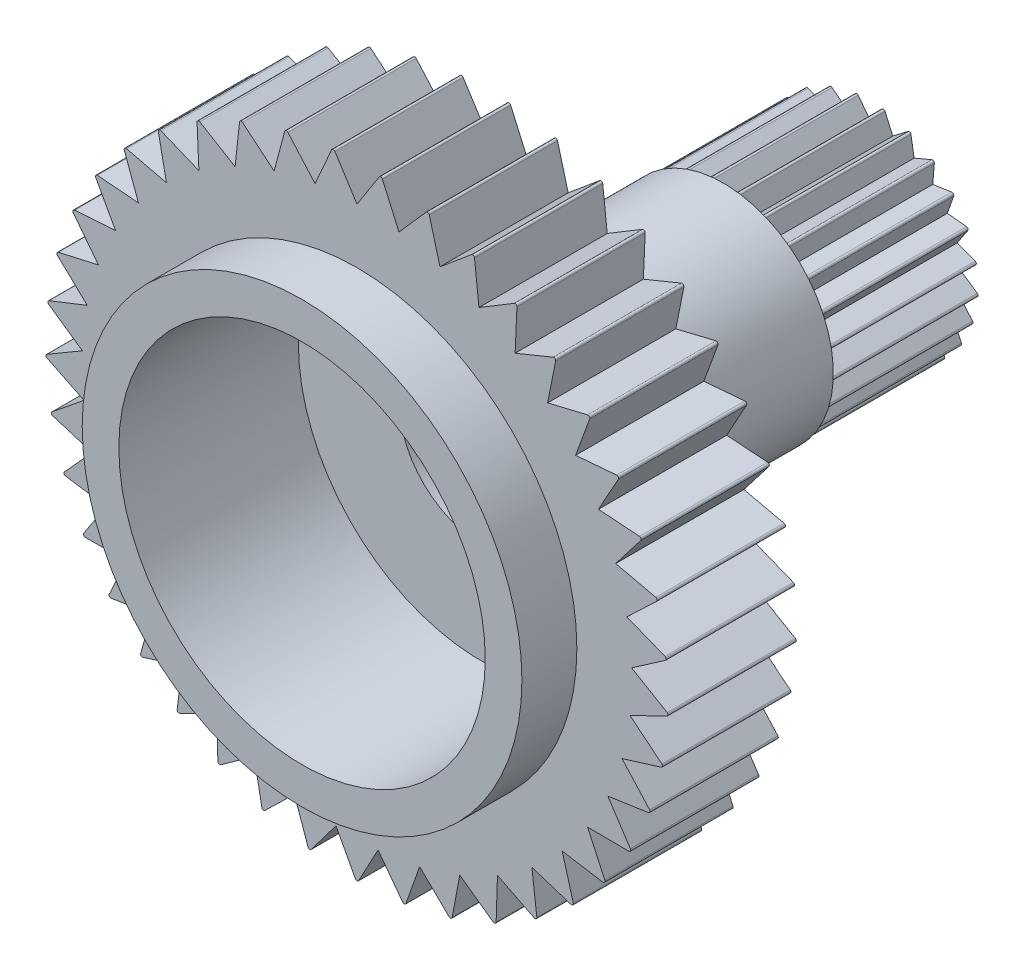
from build123d import *

# Parameters (mm, degrees)
SKETCH_1_R              = 8.55
EXTRUDE_1_DEPTH         = 3.5
SKETCH_2_R              = 6
EXTRUDE_2_DEPTH         = 1.5
SKETCH_3_R              = 3.85
EXTRUDE_3_DEPTH         = 2.4
SKETCH_4_R              = 3
EXTRUDE_4_DEPTH         = 8.1
SKETCH_5_R              = 5
CUT_EXTRUDE_5_DEPTH     = 4.9
SKETCH_6_R              = 2.25
CUT_EXTRUDE_6_DEPTH     = 2.2
CUT_EXTRUDE_START       = -4
CUT_EXTRUDE_7_OUTLINE_R = 3
CUT_EXTRUDE_7_DEPTH     = 4
SKETCH_8_R              = 1
CUT_EXTRUDE_8_DEPTH     = 7.5
CUT_EXTRUDE_START_2     = -3.5
CUT_EXTRUDE_9_OUTLINE_R = 8.55
CUT_EXTRUDE_9_DEPTH     = 3.5


# Read off the part's stored shape, not the designer's step: 伸長7, 伸長9
with BuildPart() as part:
    # 草圖1 → 伸長1 (new body)
    with BuildSketch(Plane.XY):
        Circle(SKETCH_1_R)
    extrude(amount=EXTRUDE_1_DEPTH)

    # 草圖2 → 伸長2 (add)
    with BuildSketch(Plane.XY.offset(3.5)):
        Circle(SKETCH_2_R)
    extrude(amount=EXTRUDE_2_DEPTH)

    # 草圖3 → 伸長3 (add)
    with BuildSketch(Plane(origin=(0, 0, 0), x_dir=(-1, 0, 0), z_dir=(0, 0, -1))):
        with Locations(Location((0, 0, 0), (0, 0, 180))):
            Circle(SKETCH_3_R)
    extrude(amount=EXTRUDE_3_DEPTH)

    # 草圖4 → 伸長4 (add)
    with BuildSketch(Plane(origin=(0, 0, -2.4), x_dir=(-1, 0, 0), z_dir=(0, 0, -1))):
        Circle(SKETCH_4_R)
    extrude(amount=EXTRUDE_4_DEPTH)

    # 草圖5 → 伸長5 (cut)
    with BuildSketch(Plane.XY.offset(5)):
        Circle(SKETCH_5_R)
    extrude(amount=-CUT_EXTRUDE_5_DEPTH, mode=Mode.SUBTRACT)

    # 草圖6 → 伸長6 (cut)
    with BuildSketch(Plane.XY.offset(0.1)):
        Circle(SKETCH_6_R)
    extrude(amount=-CUT_EXTRUDE_6_DEPTH, mode=Mode.SUBTRACT)

    # 伸長7 outline → 伸長7 (cut)
    with BuildSketch(Plane(origin=(0, 0, -10.5), x_dir=(-1, 0, 0), z_dir=(0, 0, -1)).offset(CUT_EXTRUDE_START)):
        Circle(CUT_EXTRUDE_7_OUTLINE_R)
        with BuildLine():
            Line((-0.324615894, 2.911247314), (0, 2.5))
            Line((0, 2.5), (0.324615894, 2.911247314))
            ThreePointArc((0.324615894, 2.911247314), (0.370129155, 2.929873953), (0.409580277, 2.900513817))
            Line((0.409580277, 2.900513817), (0.621724718, 2.421457903))
            Line((0.621724718, 2.421457903), (1.038415255, 2.739056437))
            ThreePointArc((1.038415255, 2.739056437), (1.08713089, 2.745779197), (1.118041014, 2.707530368))
            Line((1.118041014, 2.707530368), (1.204384185, 2.1907667))
            Line((1.204384185, 2.1907667), (1.686967166, 2.394760569))
            ThreePointArc((1.686967166, 2.394760569), (1.735824193, 2.389157036), (1.756251121, 2.34442283))
            Line((1.756251121, 2.34442283), (1.711367765, 1.822421569))
            Line((1.711367765, 1.822421569), (2.229520726, 1.899993088))
            ThreePointArc((2.229520726, 1.899993088), (2.275449278, 1.882415352), (2.284109512, 1.834006582))
            Line((2.284109512, 1.834006582), (2.110819814, 1.339566987))
            Line((2.110819814, 1.339566987), (2.6319853, 1.285842054))
            ThreePointArc((2.6319853, 1.285842054), (2.672099516, 1.257394588), (2.668448901, 1.208352956))
            Line((2.668448901, 1.208352956), (2.377641291, 0.772542486))
            Line((2.377641291, 0.772542486), (2.869072557, 0.590896834))
            ThreePointArc((2.869072557, 0.590896834), (2.900851914, 0.553367098), (2.885119832, 0.50677407))
            Line((2.885119832, 0.50677407), (2.495066821, 0.156976299))
            Line((2.495066821, 0.156976299), (2.925885433, -0.141176607))
            ThreePointArc((2.925885433, -0.141176607), (2.947333118, -0.185430482), (2.920508074, -0.226647295))
            Line((2.920508074, -0.226647295), (2.455718127, -0.468453286))
            Line((2.455718127, -0.468453286), (2.798854168, -0.864379403))
            ThreePointArc((2.798854168, -0.864379403), (2.808622543, -0.912576784), (2.772390052, -0.945827577))
            Line((2.772390052, -0.945827577), (2.262067631, -1.064448229))
            Line((2.262067631, -1.064448229), (2.495960601, -1.533270062))
            ThreePointArc((2.495960601, -1.533270062), (2.493435884, -1.582382529), (2.450072567, -1.605578033))
            Line((2.450072567, -1.605578033), (1.926283107, -1.593559974))
            Line((1.926283107, -1.593559974), (2.03623665, -2.105819723))
            ThreePointArc((2.03623665, -2.105819723), (2.021577478, -2.152761361), (1.973808012, -2.164444117))
            Line((1.973808012, -2.164444117), (1.469463131, -2.022542486))
            Line((1.469463131, -2.022542486), (1.448568462, -2.546052987))
            ThreePointArc((1.448568462, -2.546052987), (1.422695924, -2.587874279), (1.37352184, -2.587310217))
            Line((1.37352184, -2.587310217), (0.920311382, -2.324441215))
            Line((0.920311382, -2.324441215), (0.76988139, -2.826308378))
            ThreePointArc((0.76988139, -2.826308378), (0.734421153, -2.860381538), (0.68693224, -2.8476061))
            Line((0.68693224, -2.8476061), (0.313333084, -2.480286753))
            Line((0.313333084, -2.480286753), (0.042819839, -2.928976419))
            ThreePointArc((0.042819839, -2.928976419), (0, -2.953160506), (-0.042819839, -2.928976419))
            Line((-0.042819839, -2.928976419), (-0.313333084, -2.480286753))
            Line((-0.313333084, -2.480286753), (-0.68693224, -2.8476061))
            ThreePointArc((-0.68693224, -2.8476061), (-0.734421153, -2.860381538), (-0.76988139, -2.826308378))
            Line((-0.76988139, -2.826308378), (-0.920311382, -2.324441215))
            Line((-0.920311382, -2.324441215), (-1.37352184, -2.587310217))
            ThreePointArc((-1.37352184, -2.587310217), (-1.422695924, -2.587874279), (-1.448568462, -2.546052987))
            Line((-1.448568462, -2.546052987), (-1.469463131, -2.022542486))
            Line((-1.469463131, -2.022542486), (-1.973808012, -2.164444117))
            ThreePointArc((-1.973808012, -2.164444117), (-2.021577478, -2.152761361), (-2.03623665, -2.105819723))
            Line((-2.03623665, -2.105819723), (-1.926283107, -1.593559974))
            Line((-1.926283107, -1.593559974), (-2.450072567, -1.605578033))
            ThreePointArc((-2.450072567, -1.605578033), (-2.493435884, -1.582382529), (-2.495960601, -1.533270062))
            Line((-2.495960601, -1.533270062), (-2.262067631, -1.064448229))
            Line((-2.262067631, -1.064448229), (-2.772390052, -0.945827577))
            ThreePointArc((-2.772390052, -0.945827577), (-2.808622543, -0.912576784), (-2.798854168, -0.864379403))
            Line((-2.798854168, -0.864379403), (-2.455718127, -0.468453286))
            Line((-2.455718127, -0.468453286), (-2.920508074, -0.226647295))
            ThreePointArc((-2.920508074, -0.226647295), (-2.947333118, -0.185430482), (-2.925885433, -0.141176607))
            Line((-2.925885433, -0.141176607), (-2.495066821, 0.156976299))
            Line((-2.495066821, 0.156976299), (-2.885119832, 0.50677407))
            ThreePointArc((-2.885119832, 0.50677407), (-2.900851914, 0.553367098), (-2.869072557, 0.590896834))
            Line((-2.869072557, 0.590896834), (-2.377641291, 0.772542486))
            Line((-2.377641291, 0.772542486), (-2.668448901, 1.208352956))
            ThreePointArc((-2.668448901, 1.208352956), (-2.672099516, 1.257394588), (-2.6319853, 1.285842054))
            Line((-2.6319853, 1.285842054), (-2.110819814, 1.339566987))
            Line((-2.110819814, 1.339566987), (-2.284109512, 1.834006582))
            ThreePointArc((-2.284109512, 1.834006582), (-2.275449278, 1.882415352), (-2.229520726, 1.899993088))
            Line((-2.229520726, 1.899993088), (-1.711367765, 1.822421569))
            Line((-1.711367765, 1.822421569), (-1.756251121, 2.34442283))
            ThreePointArc((-1.756251121, 2.34442283), (-1.735824193, 2.389157036), (-1.686967166, 2.394760569))
            Line((-1.686967166, 2.394760569), (-1.204384185, 2.1907667))
            Line((-1.204384185, 2.1907667), (-1.118041014, 2.707530368))
            ThreePointArc((-1.118041014, 2.707530368), (-1.08713089, 2.745779197), (-1.038415255, 2.739056437))
            Line((-1.038415255, 2.739056437), (-0.621724718, 2.421457903))
            Line((-0.621724718, 2.421457903), (-0.409580277, 2.900513817))
            ThreePointArc((-0.409580277, 2.900513817), (-0.370129155, 2.929873953), (-0.324615894, 2.911247314))
        make_face(mode=Mode.SUBTRACT)
    extrude(amount=CUT_EXTRUDE_7_DEPTH, mode=Mode.SUBTRACT)

    # 草圖8 → 伸長8 (cut)
    with BuildSketch(Plane(origin=(0, 0, -10.5), x_dir=(-1, 0, 0), z_dir=(0, 0, -1))):
        Circle(SKETCH_8_R)
    extrude(amount=-CUT_EXTRUDE_8_DEPTH, mode=Mode.SUBTRACT)

    # 伸長9 outline → 伸長9 (cut)
    with BuildSketch(Plane.XY.offset(3.5).offset(CUT_EXTRUDE_START_2)):
        Circle(CUT_EXTRUDE_9_OUTLINE_R)
        with BuildLine():
            Line((-0.604248441, 8.446226921), (0, 7.5))
            Line((0, 7.5), (0.604248441, 8.446226921))
            ThreePointArc((0.604248441, 8.446226921), (0.650216483, 8.469169775), (0.692143589, 8.439478813))
            Line((0.692143589, 8.439478813), (1.144869632, 7.412103178))
            Line((1.144869632, 7.412103178), (1.886477399, 8.255002629))
            ThreePointArc((1.886477399, 8.255002629), (1.935408925, 8.270659614), (1.972312359, 8.234916474))
            Line((1.972312359, 8.234916474), (2.262904489, 7.15047294))
            Line((2.262904489, 7.15047294), (3.124488926, 7.870288072))
            ThreePointArc((3.124488926, 7.870288072), (3.175237023, 7.878292201), (3.206251799, 7.837334673))
            Line((3.206251799, 7.837334673), (3.327898784, 6.721241677))
            Line((3.327898784, 6.721241677), (4.289265081, 7.301100633))
            ThreePointArc((4.289265081, 7.301100633), (4.340640256, 7.301264296), (4.365039415, 7.25605239))
            Line((4.365039415, 7.25605239), (4.314889952, 6.134470206))
            Line((4.314889952, 6.134470206), (5.353504497, 6.560781583))
            ThreePointArc((5.353504497, 6.560781583), (5.40430256, 6.553100944), (5.421514207, 6.504694389))
            Line((5.421514207, 6.504694389), (5.200743756, 5.403911952))
            Line((5.200743756, 5.403911952), (6.292262306, 5.666683374))
            ThreePointArc((6.292262306, 5.666683374), (6.341292593, 5.651338461), (6.3509133, 5.600871864))
            Line((6.3509133, 5.600871864), (5.964696535, 4.546690582))
            Line((5.964696535, 4.546690582), (7.083534819, 4.639762909))
            ThreePointArc((7.083534819, 4.639762909), (7.129648102, 4.617113394), (7.131452369, 4.56576965))
            Line((7.131452369, 4.56576965), (6.588841882, 3.582898639))
            Line((6.588841882, 3.582898639), (7.70877528, 3.504090334))
            ThreePointArc((7.70877528, 3.504090334), (7.750890703, 3.474667102), (7.744836238, 3.423649665))
            Line((7.744836238, 3.423649665), (7.05855036, 2.535126588))
            Line((7.05855036, 2.535126588), (8.153328582, 2.286284851))
            ThreePointArc((8.153328582, 2.286284851), (8.190458994, 2.250777558), (8.17668771, 2.201282234))
            Line((8.17668771, 2.201282234), (7.3628124, 1.427933319))
            Line((7.3628124, 1.427933319), (8.406774772, 1.01489079))
            ThreePointArc((8.406774772, 1.01489079), (8.438049869, 0.974131696), (8.416884553, 0.927318612))
            Line((8.416884553, 0.927318612), (7.494496358, 0.287270503))
            Line((7.494496358, 0.287270503), (8.463173287, -0.280291452))
            ThreePointArc((8.463173287, -0.280291452), (8.487860006, -0.325346987), (8.459796755, -0.368380571))
            Line((8.459796755, -0.368380571), (7.450515673, -0.86012569))
            Line((7.450515673, -0.86012569), (8.321202193, -1.568903899))
            ThreePointArc((8.321202193, -1.568903899), (8.338721899, -1.617199813), (8.304418492, -1.655445226))
            Line((8.304418492, -1.655445226), (7.231901216, -1.987361266))
            Line((7.231901216, -1.987361266), (7.984189173, -2.820742569))
            ThreePointArc((7.984189173, -2.820742569), (7.994131219, -2.871146846), (7.954391697, -2.903707648))
            Line((7.954391697, -2.903707648), (6.843777124, -3.068014779))
            Line((6.843777124, -3.068014779), (7.460033525, -4.006465424))
            ThreePointArc((7.460033525, -4.006465424), (7.462164878, -4.05779663), (7.417920704, -4.083909624))
            Line((7.417920704, -4.083909624), (6.295240696, -4.076756625))
            Line((6.295240696, -4.076756625), (6.761021014, -5.098280124))
            ThreePointArc((6.761021014, -5.098280124), (6.755291717, -5.1493351), (6.707579936, -5.16838822))
            Line((6.707579936, -5.16838822), (5.599149162, -4.989942751))
            Line((5.599149162, -4.989942751), (5.903535901, -6.07059546))
            ThreePointArc((5.903535901, -6.07059546), (5.890080243, -6.12017752), (5.840019179, -6.131724176))
            Line((5.840019179, -6.131724176), (4.771818317, -5.786168849))
            Line((4.771818317, -5.786168849), (4.907676911, -6.900621184))
            ThreePointArc((4.907676911, -6.900621184), (4.886810281, -6.947568167), (4.835573323, -6.951337715))
            Line((4.835573323, -6.951337715), (3.832640096, -6.446772052))
            Line((3.832640096, -6.446772052), (3.796786133, -7.568902196))
            ThreePointArc((3.796786133, -7.568902196), (3.768997628, -7.612113703), (3.717785726, -7.608017789))
            Line((3.717785726, -7.608017789), (2.803628039, -6.956268383))
            Line((2.803628039, -6.956268383), (2.596901906, -8.059774555))
            ThreePointArc((2.596901906, -8.059774555), (2.562842865, -8.098237747), (2.512856383, -8.086372375))
            Line((2.512856383, -8.086372375), (1.708901317, -7.302715679))
            Line((1.708901317, -7.302715679), (1.336148499, -8.36173263))
            ThreePointArc((1.336148499, -8.36173263), (1.296617237, -8.394545961), (1.249027816, -8.375189245))
            Line((1.249027816, -8.375189245), (0.574119396, -7.477993509))
            Line((0.574119396, -7.477993509), (0.044076904, -8.467698779))
            ThreePointArc((0.044076904, -8.467698779), (0, -8.494093133), (-0.044076904, -8.467698779))
            Line((-0.044076904, -8.467698779), (-0.574119396, -7.477993509))
            Line((-0.574119396, -7.477993509), (-1.249027816, -8.375189245))
            ThreePointArc((-1.249027816, -8.375189245), (-1.296617237, -8.394545961), (-1.336148499, -8.36173263))
            Line((-1.336148499, -8.36173263), (-1.708901317, -7.302715679))
            Line((-1.708901317, -7.302715679), (-2.512856383, -8.086372375))
            ThreePointArc((-2.512856383, -8.086372375), (-2.562842865, -8.098237747), (-2.596901906, -8.059774555))
            Line((-2.596901906, -8.059774555), (-2.803628039, -6.956268383))
            Line((-2.803628039, -6.956268383), (-3.717785726, -7.608017789))
            ThreePointArc((-3.717785726, -7.608017789), (-3.768997628, -7.612113703), (-3.796786133, -7.568902196))
            Line((-3.796786133, -7.568902196), (-3.832640096, -6.446772052))
            Line((-3.832640096, -6.446772052), (-4.835573323, -6.951337715))
            ThreePointArc((-4.835573323, -6.951337715), (-4.886810281, -6.947568167), (-4.907676911, -6.900621184))
            Line((-4.907676911, -6.900621184), (-4.771818317, -5.786168849))
            Line((-4.771818317, -5.786168849), (-5.840019179, -6.131724176))
            ThreePointArc((-5.840019179, -6.131724176), (-5.890080243, -6.12017752), (-5.903535901, -6.07059546))
            Line((-5.903535901, -6.07059546), (-5.599149162, -4.989942751))
            Line((-5.599149162, -4.989942751), (-6.707579936, -5.16838822))
            ThreePointArc((-6.707579936, -5.16838822), (-6.755291717, -5.1493351), (-6.761021014, -5.098280124))
            Line((-6.761021014, -5.098280124), (-6.295240696, -4.076756625))
            Line((-6.295240696, -4.076756625), (-7.417920704, -4.083909624))
            ThreePointArc((-7.417920704, -4.083909624), (-7.462164878, -4.05779663), (-7.460033525, -4.006465424))
            Line((-7.460033525, -4.006465424), (-6.843777124, -3.068014779))
            Line((-6.843777124, -3.068014779), (-7.954391697, -2.903707648))
            ThreePointArc((-7.954391697, -2.903707648), (-7.994131219, -2.871146846), (-7.984189173, -2.820742569))
            Line((-7.984189173, -2.820742569), (-7.231901216, -1.987361266))
            Line((-7.231901216, -1.987361266), (-8.304418492, -1.655445226))
            ThreePointArc((-8.304418492, -1.655445226), (-8.338721899, -1.617199813), (-8.321202193, -1.568903899))
            Line((-8.321202193, -1.568903899), (-7.450515673, -0.86012569))
            Line((-7.450515673, -0.86012569), (-8.459796755, -0.368380571))
            ThreePointArc((-8.459796755, -0.368380571), (-8.487860006, -0.325346987), (-8.463173287, -0.280291452))
            Line((-8.463173287, -0.280291452), (-7.494496358, 0.287270503))
            Line((-7.494496358, 0.287270503), (-8.416884553, 0.927318612))
            ThreePointArc((-8.416884553, 0.927318612), (-8.438049869, 0.974131696), (-8.406774772, 1.01489079))
            Line((-8.406774772, 1.01489079), (-7.3628124, 1.427933319))
            Line((-7.3628124, 1.427933319), (-8.17668771, 2.201282234))
            ThreePointArc((-8.17668771, 2.201282234), (-8.190458994, 2.250777558), (-8.153328582, 2.286284851))
            Line((-8.153328582, 2.286284851), (-7.05855036, 2.535126588))
            Line((-7.05855036, 2.535126588), (-7.744836238, 3.423649665))
            ThreePointArc((-7.744836238, 3.423649665), (-7.750890703, 3.474667102), (-7.70877528, 3.504090334))
            Line((-7.70877528, 3.504090334), (-6.588841882, 3.582898639))
            Line((-6.588841882, 3.582898639), (-7.131452369, 4.56576965))
            ThreePointArc((-7.131452369, 4.56576965), (-7.129648102, 4.617113394), (-7.083534819, 4.639762909))
            Line((-7.083534819, 4.639762909), (-5.964696535, 4.546690582))
            Line((-5.964696535, 4.546690582), (-6.3509133, 5.600871864))
            ThreePointArc((-6.3509133, 5.600871864), (-6.341292593, 5.651338461), (-6.292262306, 5.666683374))
            Line((-6.292262306, 5.666683374), (-5.200743756, 5.403911952))
            Line((-5.200743756, 5.403911952), (-5.421514207, 6.504694389))
            ThreePointArc((-5.421514207, 6.504694389), (-5.40430256, 6.553100944), (-5.353504497, 6.560781583))
            Line((-5.353504497, 6.560781583), (-4.314889952, 6.134470206))
            Line((-4.314889952, 6.134470206), (-4.365039415, 7.25605239))
            ThreePointArc((-4.365039415, 7.25605239), (-4.340640256, 7.301264296), (-4.289265081, 7.301100633))
            Line((-4.289265081, 7.301100633), (-3.327898784, 6.721241677))
            Line((-3.327898784, 6.721241677), (-3.206251799, 7.837334673))
            ThreePointArc((-3.206251799, 7.837334673), (-3.175237023, 7.878292201), (-3.124488926, 7.870288072))
            Line((-3.124488926, 7.870288072), (-2.262904489, 7.15047294))
            Line((-2.262904489, 7.15047294), (-1.972312359, 8.234916474))
            ThreePointArc((-1.972312359, 8.234916474), (-1.935408925, 8.270659614), (-1.886477399, 8.255002629))
            Line((-1.886477399, 8.255002629), (-1.144869632, 7.412103178))
            Line((-1.144869632, 7.412103178), (-0.692143589, 8.439478813))
            ThreePointArc((-0.692143589, 8.439478813), (-0.650216483, 8.469169775), (-0.604248441, 8.446226921))
        make_face(mode=Mode.SUBTRACT)
    extrude(amount=CUT_EXTRUDE_9_DEPTH, mode=Mode.SUBTRACT)


solid = part.part
